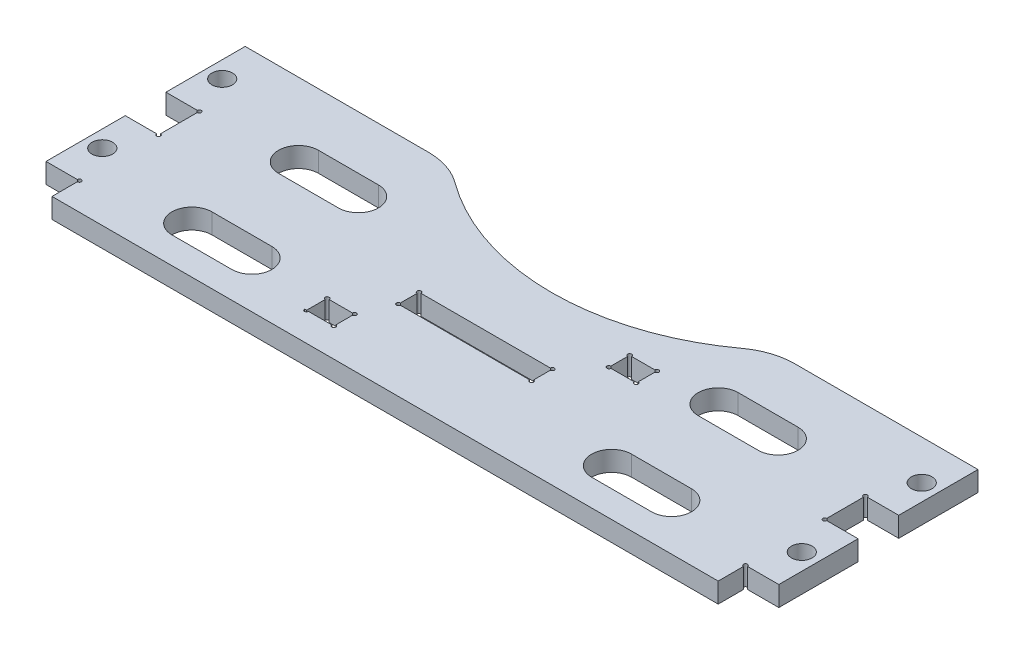
from build123d import *

# Parameters (mm, degrees)
BOSS_EXTRUDE1_DEPTH = 3
SKETCH2_W           = 4.1
SKETCH2_H           = 3.1
CUT_EXTRUDE1_DEPTH  = 10
SKETCH5_W           = 20
SKETCH5_H           = 3.1
SKETCH5_R           = 1.55
CUT_EXTRUDE3_DEPTH  = 3
CUT_EXTRUDE2_DEPTH  = 10
FILLET1_R           = 10


with BuildPart() as part:
    # Sketch1 → Boss-Extrude1 (new body)
    with BuildSketch(Plane(origin=(0, 0, 0), x_dir=(1, 0, 0), z_dir=(0, 1, 0))):
        with BuildLine():
            Line((55, 34), (55, 22.1))
            Line((55, 22.1), (50, 22.1))
            Line((50, 22.1), (50, 16))
            Line((50, 16), (55, 16))
            Line((55, 16), (55, 4.1))
            Line((55, 4.1), (50, 4.1))
            Line((50, 4.1), (50, 0))
            Line((50, 0), (-50, 0))
            Line((-50, 0), (-50, 4.1))
            Line((-50, 4.1), (-55, 4.1))
            Line((-55, 4.1), (-55, 16))
            Line((-55, 16), (-50, 16))
            Line((-50, 16), (-50, 22.1))
            Line((-50, 22.1), (-55, 22.1))
            Line((-55, 22.1), (-55, 34))
            Line((-55, 34), (-50, 34))
            Line((-50, 34), (-24, 34))
            ThreePointArc((-24, 34), (0, 25), (24, 34))
            Line((24, 34), (50, 34))
            Line((50, 34), (55, 34))
        make_face()
        with BuildLine():
            Line((27, 10), (36, 10))
            ThreePointArc((36, 10), (39, 7), (36, 4))
            Line((36, 4), (27, 4))
            ThreePointArc((27, 4), (24, 7), (27, 10))
        make_face(mode=Mode.SUBTRACT)
        with BuildLine():
            Line((-27, 20), (-36, 20))
            ThreePointArc((-36, 20), (-39, 23), (-36, 26))
            Line((-36, 26), (-27, 26))
            ThreePointArc((-27, 26), (-24, 23), (-27, 20))
        make_face(mode=Mode.SUBTRACT)
        with BuildLine():
            Line((36, 26), (27, 26))
            ThreePointArc((27, 26), (24, 23), (27, 20))
            Line((27, 20), (36, 20))
            ThreePointArc((36, 20), (39, 23), (36, 26))
        make_face(mode=Mode.SUBTRACT)
        with BuildLine():
            Line((-36, 4), (-27, 4))
            ThreePointArc((-27, 4), (-24, 7), (-27, 10))
            Line((-27, 10), (-36, 10))
            ThreePointArc((-36, 10), (-39, 7), (-36, 4))
        make_face(mode=Mode.SUBTRACT)
    extrude(amount=BOSS_EXTRUDE1_DEPTH)

    # Sketch2 → Cut-Extrude1 (cut)
    with BuildSketch(Plane(origin=(0, 3, 0), x_dir=(1, 0, 0), z_dir=(0, 1, 0))):
        with Locations((-14.05, 5.85)):
            Rectangle(SKETCH2_W, SKETCH2_H)
        with Locations((16.05, 21.15)):
            Rectangle(SKETCH2_W, SKETCH2_H)
    extrude(amount=-CUT_EXTRUDE1_DEPTH, mode=Mode.SUBTRACT)

    # Sketch5 → Cut-Extrude3 (cut)
    with BuildSketch(Plane(origin=(0, 3, 0), x_dir=(1, 0, 0), z_dir=(0, 1, 0))):
        with Locations((0, 13.55)):
            Rectangle(SKETCH5_W, SKETCH5_H)
        with Locations((52.5, 28.05)):
            Circle(SKETCH5_R)
        with Locations((52.5, 10.05)):
            Circle(SKETCH5_R)
        with Locations((-52.5, 10.05)):
            Circle(SKETCH5_R)
        with Locations((-52.5, 28.05)):
            Circle(SKETCH5_R)
    extrude(amount=-CUT_EXTRUDE3_DEPTH, mode=Mode.SUBTRACT)

    # Sketch4 → Cut-Extrude2 (cut)
    with BuildSketch(Plane(origin=(0, 3, 0), x_dir=(1, 0, 0), z_dir=(0, 1, 0))):
        with BuildLine():
            ThreePointArc((-50, 3.8), (-49.787867966, 4.312132034), (-50.3, 4.1))
            Line((-50.3, 4.1), (-50, 4.1))
            Line((-50, 4.1), (-50, 3.8))
        make_face()
        with BuildLine():
            ThreePointArc((-50, 21.8), (-49.787867966, 22.312132034), (-50.3, 22.1))
            Line((-50.3, 22.1), (-50, 22.1))
            Line((-50, 22.1), (-50, 21.8))
        make_face()
        with BuildLine():
            ThreePointArc((-50.3, 16), (-49.787867966, 15.787867966), (-50, 16.3))
            Line((-50, 16.3), (-50, 16))
            Line((-50, 16), (-50.3, 16))
        make_face()
        with BuildLine():
            ThreePointArc((50.3, 22.1), (49.787867966, 22.312132034), (50, 21.8))
            Line((50, 21.8), (50, 22.1))
            Line((50, 22.1), (50.3, 22.1))
        make_face()
        with BuildLine():
            Line((50.3, 16), (50, 16))
            Line((50, 16), (50, 16.3))
            ThreePointArc((50, 16.3), (49.787867966, 15.787867966), (50.3, 16))
        make_face()
        with BuildLine():
            Line((50, 3.8), (50, 4.1))
            Line((50, 4.1), (50.3, 4.1))
            ThreePointArc((50.3, 4.1), (49.787867966, 4.312132034), (50, 3.8))
        make_face()
        with BuildLine():
            ThreePointArc((-15.8, 7.4), (-16.312132034, 7.612132034), (-16.1, 7.1))
            Line((-16.1, 7.1), (-16.1, 7.4))
            Line((-16.1, 7.4), (-15.8, 7.4))
        make_face()
        with BuildLine():
            ThreePointArc((-12, 7.1), (-11.787867966, 7.612132034), (-12.3, 7.4))
            Line((-12.3, 7.4), (-12, 7.4))
            Line((-12, 7.4), (-12, 7.1))
        make_face()
        with BuildLine():
            Line((-16.1, 4.3), (-16.1, 4.316031728))
            Line((-16.1, 4.316031728), (-16.39950104, 4.317295286))
            ThreePointArc((-16.39950104, 4.317295286), (-16.108651241, 4.000124766), (-15.8, 4.3))
            Line((-15.8, 4.3), (-16.1, 4.3))
        make_face()
        with BuildLine():
            Line((-12, 4.3), (-12.3, 4.3))
            ThreePointArc((-12.3, 4.3), (-11.787867966, 4.087867966), (-12, 4.6))
            Line((-12, 4.6), (-12, 4.3))
        make_face()
        with BuildLine():
            ThreePointArc((14.3, 22.7), (13.787867966, 22.912132034), (14, 22.4))
            Line((14, 22.4), (14, 22.7))
            Line((14, 22.7), (14.3, 22.7))
        make_face()
        with BuildLine():
            Line((14, 19.6), (14, 19.9))
            ThreePointArc((14, 19.9), (13.787867966, 19.387867966), (14.3, 19.6))
            Line((14.3, 19.6), (14, 19.6))
        make_face()
        with BuildLine():
            ThreePointArc((18.1, 22.4), (18.312132034, 22.912132034), (17.8, 22.7))
            Line((17.8, 22.7), (18.1, 22.7))
            Line((18.1, 22.7), (18.1, 22.4))
        make_face()
        with BuildLine():
            Line((18.1, 19.6), (17.8, 19.6))
            ThreePointArc((17.8, 19.6), (18.312132034, 19.387867966), (18.1, 19.9))
            Line((18.1, 19.9), (18.1, 19.6))
        make_face()
        with BuildLine():
            ThreePointArc((-9.7, 15.1), (-10.212132034, 15.312132034), (-10, 14.8))
            Line((-10, 14.8), (-10, 15.1))
            Line((-10, 15.1), (-9.7, 15.1))
        make_face()
        with BuildLine():
            ThreePointArc((10, 14.8), (10.212132034, 15.312132034), (9.7, 15.1))
            Line((9.7, 15.1), (10, 15.1))
            Line((10, 15.1), (10, 14.8))
        make_face()
        with BuildLine():
            ThreePointArc((9.7, 12), (10.212132034, 11.787867966), (10, 12.3))
            Line((10, 12.3), (10, 12))
            Line((10, 12), (9.7, 12))
        make_face()
        with BuildLine():
            ThreePointArc((-10, 12.3), (-10.212132034, 11.787867966), (-9.7, 12))
            Line((-9.7, 12), (-10, 12))
            Line((-10, 12), (-10, 12.3))
        make_face()
    extrude(amount=-CUT_EXTRUDE2_DEPTH, mode=Mode.SUBTRACT)

    # Fillet1
    fillet1_edges = [part.edges().sort_by_distance(p)[0] for p in [
        (24, 1.5, -34),
        (-24, 1.5, -34),
    ]]
    fillet(fillet1_edges, radius=FILLET1_R)


solid = part.part
